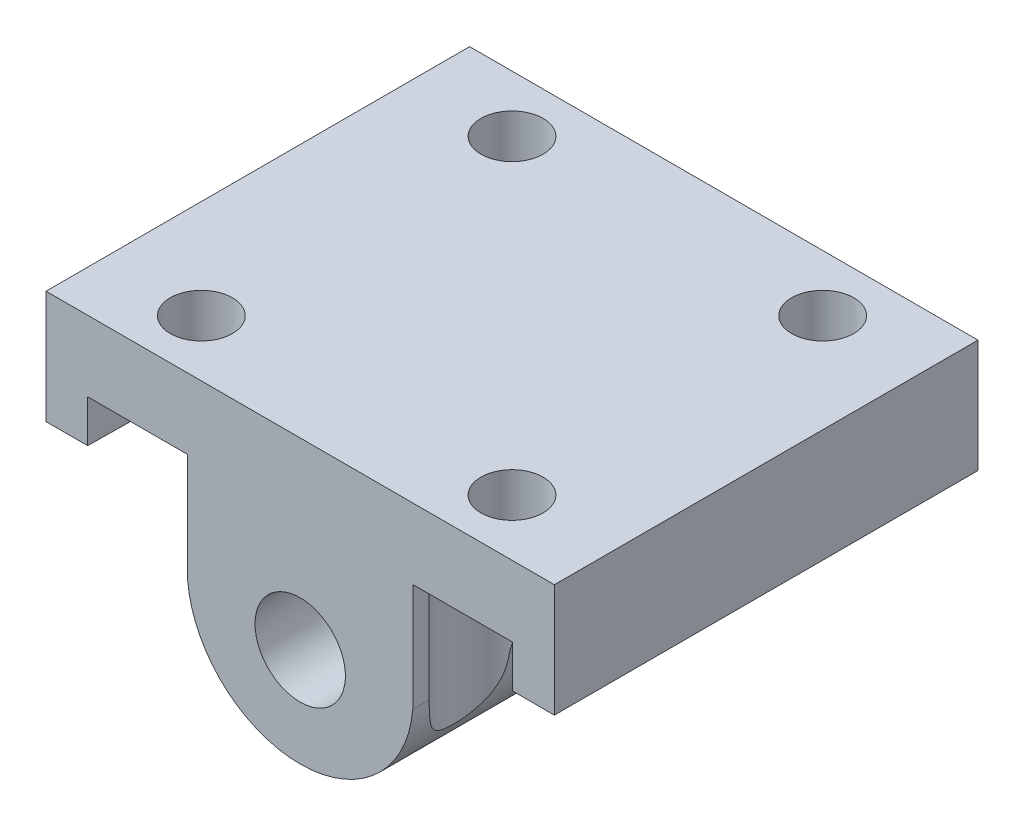
from build123d import *
from build123d.topology import SkipClean

# Parameters (mm, degrees)
SKETCH1_W            = 60
SKETCH1_H            = 42
BOSS_EXTRUDE1_DEPTH  = 8
SKETCH3_W            = 10
SKETCH3_H            = 42
BOSS_EXTRUDE5_DEPTH  = 6
SKETCH5_W            = 14
SKETCH5_H            = 42
BOSS_EXTRUDE6_DEPTH  = 11
SKETCH6_R            = 3.2
CUT_EXTRUDE1_DEPTH   = 75.565407529
FILLET1_R            = 7
FILLET2_R            = 5
FILLET3_R            = 5
BOSS_EXTRUDE7_DEPTH  = 42
SKETCH9_W            = 5
SKETCH9_H            = 42
BOSS_EXTRUDE8_DEPTH  = 6
SKETCH11_W           = 15
SKETCH11_H           = 42
CUT_EXTRUDE2_DEPTH   = 76.921011584
SKETCH12_W           = 30
SKETCH12_H           = 42
CUT_EXTRUDE3_DEPTH   = 6
SKETCH15_W           = 42
SKETCH15_H           = 8
BOSS_EXTRUDE9_DEPTH  = 5
SKETCH16_W           = 42
SKETCH16_H           = 8
BOSS_EXTRUDE10_DEPTH = 5
CUT_EXTRUDE7_START   = -17
CUT_EXTRUDE7_DEPTH   = 17
BOSS_EXTRUDE11_START = -5
SKETCH17_R           = 4.15
SKETCH17_R_2         = 2.2
BOSS_EXTRUDE11_DEPTH = 5
SKETCH18_W           = 2
SKETCH18_H           = 42
CUT_EXTRUDE8_DEPTH   = 67.392770772
CUT_EXTRUDE9_START   = -6
SKETCH19_R           = 3.2
CUT_EXTRUDE9_DEPTH   = 6
CUT_EXTRUDE10_DEPTH  = 6
SKETCH21_W           = 6.443242803
SKETCH21_H           = 1.161907564
SKETCH21_W_2         = 5.84761327
SKETCH21_H_2         = 1.16
SKETCH21_W_3         = 6.146169824
CUT_EXTRUDE11_DEPTH  = 6
CUT_EXTRUDE12_DEPTH  = 3
BOSS_EXTRUDE12_DEPTH = 6
BOSS_EXTRUDE13_DEPTH = 6


with BuildPart() as part:
    # Sketch1 → Boss-Extrude1 (new body)
    with BuildSketch(Plane(origin=(0, 0, 0), x_dir=(1, 0, 0), z_dir=(0, 1, 0))):
        with Locations((30, 21)):
            Rectangle(SKETCH1_W, SKETCH1_H)
    extrude(amount=BOSS_EXTRUDE1_DEPTH)

    # Sketch3 → Boss-Extrude5 (add)
    with BuildSketch(Plane(origin=(0, 8, 0), x_dir=(1, 0, 0), z_dir=(0, 1, 0))):
        with Locations((30, 21)):
            Rectangle(SKETCH3_W, SKETCH3_H)
    extrude(amount=BOSS_EXTRUDE5_DEPTH)

    # Sketch5 → Boss-Extrude6 (add)
    with BuildSketch(Plane.XZ):
        with Locations((30, -21)):
            Rectangle(SKETCH5_W, SKETCH5_H)
    extrude(amount=BOSS_EXTRUDE6_DEPTH)

    # Sketch6 → Cut-Extrude1 (cut, through all)
    with BuildSketch(Plane(origin=(0, 0, -42), x_dir=(-1, 0, 0), z_dir=(0, 0, -1))):
        with Locations((-30, -5)):
            Circle(SKETCH6_R)
    extrude(amount=-CUT_EXTRUDE1_DEPTH, mode=Mode.SUBTRACT)

    # Fillet1
    fillet1_edges = [part.edges().sort_by_distance(p)[0] for p in [
        (23, -11, -21),
        (37, -11, -21),
    ]]
    fillet(fillet1_edges, radius=FILLET1_R - 0.0001)  # a hair under: the kernel refuses the full size

    # Fillet2
    fillet2_edges = [part.edges().sort_by_distance(p)[0] for p in [
        (23, 0, -21),
    ]]
    fillet(fillet2_edges, radius=FILLET2_R)

    # Fillet3
    fillet3_edges = [part.edges().sort_by_distance(p)[0] for p in [
        (37, 0, -21),
    ]]
    fillet(fillet3_edges, radius=FILLET3_R)

    # Sketch8 → Boss-Extrude7 (add)
    with BuildSketch(Plane(origin=(0, 0, -42), x_dir=(-1, 0, 0), z_dir=(0, 0, -1))):
        with BuildLine():
            Line((-41.958260743, -1), (-42.958260743, 0))
            Line((-42.958260743, 0), (-41.958260743, 0))
            ThreePointArc((-41.958260743, 0), (-38.573244741, -1.320099639), (-36.9756521, -4.583333333))
            ThreePointArc((-36.9756521, -4.583333333), (-34.739022403, -9.151860505), (-30, -11))
            ThreePointArc((-30, -11), (-25.260977597, -9.151860505), (-23.0243479, -4.583333333))
            ThreePointArc((-23.0243479, -4.583333333), (-21.426755259, -1.320099639), (-18.041739257, 0))
            Line((-18.041739257, 0), (-16.803044796, 0))
            Line((-16.803044796, 0), (-18.041739257, -1))
            ThreePointArc((-18.041739257, -1), (-20.749752058, -2.056079711), (-22.027826171, -4.666666667))
            ThreePointArc((-22.027826171, -4.666666667), (-24.583974397, -9.887840578), (-30, -12))
            ThreePointArc((-30, -12), (-35.416025603, -9.887840578), (-37.972173829, -4.666666667))
            ThreePointArc((-37.972173829, -4.666666667), (-39.250247942, -2.056079711), (-41.958260743, -1))
        make_face()
    extrude(amount=-BOSS_EXTRUDE7_DEPTH)

    # Sketch9 → Boss-Extrude8 (add)
    with BuildSketch(Plane(origin=(0, 8, 0), x_dir=(1, 0, 0), z_dir=(0, 1, 0))):
        with Locations((42.5, 21)):
            Rectangle(SKETCH9_W, SKETCH9_H)
        with Locations((17.5, 21)):
            Rectangle(SKETCH9_W, SKETCH9_H)
    extrude(amount=BOSS_EXTRUDE8_DEPTH)

    # Sketch11 → Cut-Extrude2 (cut, through all)
    with BuildSketch(Plane(origin=(0, 8, 0), x_dir=(1, 0, 0), z_dir=(0, 1, 0))):
        with Locations((52.5, 21)):
            Rectangle(SKETCH11_W, SKETCH11_H)
        with Locations((7.5, 21)):
            Rectangle(SKETCH11_W, SKETCH11_H)
    extrude(amount=-CUT_EXTRUDE2_DEPTH, mode=Mode.SUBTRACT)

    # Sketch12 → Cut-Extrude3 (cut)
    with BuildSketch(Plane(origin=(0, 14, 0), x_dir=(1, 0, 0), z_dir=(0, 1, 0))):
        with Locations((30, 21)):
            Rectangle(SKETCH12_W, SKETCH12_H)
    extrude(amount=-CUT_EXTRUDE3_DEPTH, mode=Mode.SUBTRACT)

    # Sketch15 → Boss-Extrude9 (add)
    with BuildSketch(Plane.ZY.offset(-15)):
        with Locations((-21, 4)):
            Rectangle(SKETCH15_W, SKETCH15_H)
    extrude(amount=BOSS_EXTRUDE9_DEPTH)

    # Sketch16 → Boss-Extrude10 (add)
    with BuildSketch(Plane(origin=(45, 0, 0), x_dir=(0, 0, -1), z_dir=(1, 0, 0))):
        with Locations((21, 4)):
            Rectangle(SKETCH16_W, SKETCH16_H)
    extrude(amount=BOSS_EXTRUDE10_DEPTH)

    # Cut-Extrude7: read off the stored shape, not the designer's step
    # Cut-Extrude7 outline → Cut-Extrude7 (cut)
    with BuildSketch(Plane(origin=(0, 8, 0), x_dir=(1, 0, 0), z_dir=(0, 1, 0)).offset(CUT_EXTRUDE7_START)):
        with BuildLine():
            ThreePointArc((45, 33.105667219), (36.85, 32), (45, 30.894332781))
            Line((45, 30.894332781), (45, 33.105667219))
        make_face()
        with BuildLine():
            ThreePointArc((45, 11.105667219), (36.85, 10), (45, 8.894332781))
            Line((45, 8.894332781), (45, 11.105667219))
        make_face()
        with BuildLine():
            ThreePointArc((15, 8.894332781), (23.15, 10), (15, 11.105667219))
            Line((15, 11.105667219), (15, 8.894332781))
        make_face()
        with BuildLine():
            ThreePointArc((15, 30.894332781), (23.15, 32), (15, 33.105667219))
            Line((15, 33.105667219), (15, 30.894332781))
        make_face()
    extrude(amount=CUT_EXTRUDE7_DEPTH, mode=Mode.SUBTRACT)

    # Sketch17 → Boss-Extrude11 (add)
    # profile 1 of 4: a face of its own
    with BuildSketch(Plane(origin=(0, 8, 0), x_dir=(1, 0, 0), z_dir=(0, 1, 0)).offset(BOSS_EXTRUDE11_START)):
        with Locations((41, 32)):
            Circle(SKETCH17_R)
        with Locations(Location((41, 32, 0), (0, 0, 270))):
            Circle(SKETCH17_R_2, mode=Mode.SUBTRACT)
    # profile 2 of 4: a face of its own
    with BuildSketch(Plane(origin=(0, 8, 0), x_dir=(1, 0, 0), z_dir=(0, 1, 0)).offset(BOSS_EXTRUDE11_START)):
        with Locations((19, 10)):
            Circle(SKETCH17_R)
        with Locations(Location((19, 10, 0), (0, 0, 270))):
            Circle(SKETCH17_R_2, mode=Mode.SUBTRACT)
    # profile 3 of 4: a face of its own
    with BuildSketch(Plane(origin=(0, 8, 0), x_dir=(1, 0, 0), z_dir=(0, 1, 0)).offset(BOSS_EXTRUDE11_START)):
        with Locations((41, 10)):
            Circle(SKETCH17_R)
        with Locations(Location((41, 10, 0), (0, 0, 270))):
            Circle(SKETCH17_R_2, mode=Mode.SUBTRACT)
    # profile 4 of 4: a face of its own
    with BuildSketch(Plane(origin=(0, 8, 0), x_dir=(1, 0, 0), z_dir=(0, 1, 0)).offset(BOSS_EXTRUDE11_START)):
        with Locations((19, 32)):
            Circle(SKETCH17_R)
        with Locations(Location((19, 32, 0), (0, 0, 270))):
            Circle(SKETCH17_R_2, mode=Mode.SUBTRACT)
    extrude(amount=BOSS_EXTRUDE11_DEPTH)

    # Sketch18 → Cut-Extrude8 (cut, through all)
    with BuildSketch(Plane.XZ):
        with Locations((11, -21)):
            Rectangle(SKETCH18_W, SKETCH18_H)
        with Locations((49, -21)):
            Rectangle(SKETCH18_W, SKETCH18_H)
    extrude(amount=-CUT_EXTRUDE8_DEPTH, mode=Mode.SUBTRACT)

    # Sketch19 → Cut-Extrude9 (cut)
    with BuildSketch(Plane.XY.offset(CUT_EXTRUDE9_START)):
        with BuildLine():
            Line((48, 8), (48, 0))
            Line((48, 0), (42.958260743, 0))
            Line((42.958260743, 0), (41.958260743, -1))
            ThreePointArc((41.958260743, -1), (39.250247942, -2.056079711), (37.972173829, -4.666666667))
            ThreePointArc((37.972173829, -4.666666667), (30, -12), (22.027826171, -4.666666667))
            ThreePointArc((22.027826171, -4.666666667), (20.749752058, -2.056079711), (18.041739257, -1))
            Line((18.041739257, -1), (16.803044796, 0))
            Line((16.803044796, 0), (12, 0))
            Line((12, 0), (12, 8))
            Line((12, 8), (48, 8))
        make_face()
        with Locations(Location((30, -5, 0), (0, 0, 180))):
            Circle(SKETCH19_R, mode=Mode.SUBTRACT)
    extrude(amount=CUT_EXTRUDE9_DEPTH, mode=Mode.SUBTRACT)

    # Sketch20 → Cut-Extrude10 (cut)
    with BuildSketch(Plane(origin=(0, 0, -42), x_dir=(-1, 0, 0), z_dir=(0, 0, -1))):
        with BuildLine():
            Line((-16.803044796, 0), (-12, 0))
            Line((-12, 0), (-12, 8))
            Line((-12, 8), (-48, 8))
            Line((-48, 8), (-48, 0))
            Line((-48, 0), (-42.958260743, 0))
            Line((-42.958260743, 0), (-41.958260743, -1))
            ThreePointArc((-41.958260743, -1), (-39.250247942, -2.056079711), (-37.972173829, -4.666666667))
            ThreePointArc((-37.972173829, -4.666666667), (-30, -12), (-22.027826171, -4.666666667))
            ThreePointArc((-22.027826171, -4.666666667), (-20.749752058, -2.056079711), (-18.041739257, -1))
            Line((-18.041739257, -1), (-16.803044796, 0))
        make_face()
    extrude(amount=-CUT_EXTRUDE10_DEPTH, mode=Mode.SUBTRACT)

    # Sketch21 → Cut-Extrude11 (cut)
    with BuildSketch(Plane(origin=(0, 0, 0), x_dir=(-1, 0, 0), z_dir=(0, -1, 0))):
        with Locations((-18.806204769, 6.580953782)):
            Rectangle(SKETCH21_W, SKETCH21_H)
        with Locations((-19.104019536, 35.42)):
            Rectangle(SKETCH21_W_2, SKETCH21_H_2)
        with Locations((-41.045258741, 6.58)):
            Rectangle(SKETCH21_W_3, SKETCH21_H_2)
        with Locations((-41.045258741, 35.42)):
            Rectangle(SKETCH21_W_3, SKETCH21_H_2)
    extrude(amount=CUT_EXTRUDE11_DEPTH, mode=Mode.SUBTRACT)

    # Sketch22 → Cut-Extrude12 (cut, symmetric)
    with BuildSketch(Plane(origin=(0, 0, 0), x_dir=(-1, 0, 0), z_dir=(0, -1, 0))):
        Polygon((-36.85, 10), (-45, 10), (-45.05283361, 6), (-36.85, 6), align=None)
        Polygon((-45.05283361, 36), (-36.85, 36), (-36.85, 32), (-45, 32), align=None)
        Polygon((-14.94716639, 6), (-23.15, 6), (-23.15, 10), (-15, 10), align=None)
        Polygon((-15, 32), (-14.94716639, 36), (-23.15, 36), (-23.15, 32), align=None)
    extrude(amount=CUT_EXTRUDE12_DEPTH, both=True, mode=Mode.SUBTRACT)

    # Sketch24 → Boss-Extrude12 (add)
    with SkipClean():  # the faces are left unmerged after this step: merging them gives an invalid solid
        with BuildSketch(Plane(origin=(0, -3, 0), x_dir=(1, 0, 0), z_dir=(0, 1, 0))):
            with BuildLine():
                Line((22.027826171, 34.84), (22.026037012, 34.84))
                ThreePointArc((22.026037012, 34.84), (22.858792143, 33.527161812), (23.15, 32))
                Line((23.15, 32), (23.15, 36))
                Line((23.15, 36), (22.027826171, 36))
                Line((22.027826171, 36), (22.027826171, 34.84))
            make_face()
        extrude(amount=BOSS_EXTRUDE12_DEPTH)

    # Sketch25 → Boss-Extrude13 (add)
    with SkipClean():  # the faces are left unmerged after this step: merging them gives an invalid solid
        with BuildSketch(Plane(origin=(0, -3, 0), x_dir=(1, 0, 0), z_dir=(0, 1, 0))):
            with BuildLine():
                Line((37.973962988, 34.84), (37.972173829, 34.84))
                Line((37.972173829, 34.84), (37.972173829, 36))
                Line((37.972173829, 36), (36.85, 36))
                Line((36.85, 36), (36.85, 32))
                ThreePointArc((36.85, 32), (37.141207857, 33.527161812), (37.973962988, 34.84))
            make_face()
            with BuildLine():
                Line((36.85, 10), (36.85, 6))
                Line((36.85, 6), (37.972173829, 6))
                Line((37.972173829, 6), (37.972173829, 7.16))
                Line((37.972173829, 7.16), (37.973962988, 7.16))
                ThreePointArc((37.973962988, 7.16), (37.141207857, 8.472838188), (36.85, 10))
            make_face()
            with BuildLine():
                Line((22.027826171, 7.161907564), (22.027826171, 6))
                Line((22.027826171, 6), (23.15, 6))
                Line((23.15, 6), (23.15, 10))
                ThreePointArc((23.15, 10), (22.859273158, 8.474054164), (22.027826171, 7.161907564))
            make_face()
        extrude(amount=BOSS_EXTRUDE13_DEPTH)


solid = part.part
